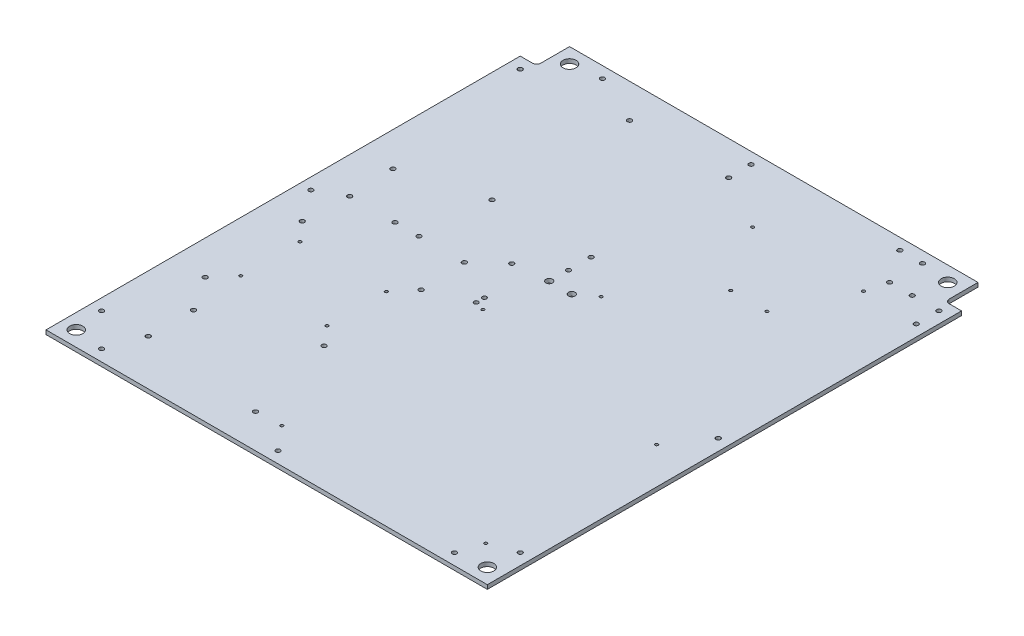
from build123d import *

# Parameters (mm, degrees)
SKETCH1_W                 = 340.868
SKETCH1_H                 = 391.668
BOSS_EXTRUDE1_DEPTH       = 3.175
CUT_EXTRUDE1_DEPTH        = 10
F_3_8_CLEARANCE_HOLE1_D   = 10.0838
F_4_40_TAPPED_HOLE2_D     = 2.2606
F_8_32_TAPPED_HOLE2_D     = 3.4544
F_4_CLEARANCE_HOLE1_D     = 3.2639
F_4_CLEARANCE_HOLE1_DEPTH = 8.01
F_4_CLEARANCE_HOLE1_TIP   = 0.980574487
F_10_CLEARANCE_HOLE1_D    = 5.1054


with BuildPart() as part:
    # Sketch1 → Boss-Extrude1 (new body)
    with BuildSketch(Plane(origin=(0, 0, 0), x_dir=(1, 0, 0), z_dir=(0, 1, 0))):
        Rectangle(SKETCH1_W, SKETCH1_H)
    extrude(amount=BOSS_EXTRUDE1_DEPTH)

    # Sketch2 → Cut-Extrude1 (cut)
    with BuildSketch(Plane(origin=(0, 3.175, 0), x_dir=(1, 0, 0), z_dir=(0, 1, 0))):
        with BuildLine():
            Line((-170.434, 195.834), (-157.734, 195.834))
            Line((-157.734, 195.834), (-157.734, 173.609))
            ThreePointArc((-157.734, 173.609), (-158.66393597, 171.36393597), (-160.909, 170.434))
            Line((-160.909, 170.434), (-170.434, 170.434))
            Line((-170.434, 170.434), (-170.434, 195.834))
        make_face()
        with BuildLine():
            Line((170.434, 195.834), (157.734, 195.834))
            Line((157.734, 195.834), (157.734, 173.609))
            ThreePointArc((157.734, 173.609), (158.66393597, 171.36393597), (160.909, 170.434))
            Line((160.909, 170.434), (170.434, 170.434))
            Line((170.434, 170.434), (170.434, 195.834))
        make_face()
    extrude(amount=-CUT_EXTRUDE1_DEPTH, mode=Mode.SUBTRACT)

    # 3/8 Clearance Hole1 (through all)
    with Locations(Plane(origin=(0, 3.175, 0), x_dir=(1, 0, 0), z_dir=(0, 1, 0))):
        with Locations((158.75, -184.15), (-158.75, -184.15), (-146.05, 184.15), (146.05, 184.15)):
            Hole(F_3_8_CLEARANCE_HOLE1_D / 2)

    # #4-40 Tapped Hole2 (through all)
    with Locations(Plane(origin=(0, 3.175, 0), x_dir=(1, 0, 0), z_dir=(0, 1, 0))):
        with Locations((119.375, 145.759), (33.725, 145.759), (21.73, 40.754), (67.7, 94.894), (95.6, 94.894), (-15.34, -13.51), (142.14, -36.73), (-15.34, -168.81), (142.14, -168.81), (-64.65313, -38.806), (-64.65313, -84.526), (-131.32813, -38.806), (-131.32813, -84.526)):
            Hole(F_4_40_TAPPED_HOLE2_D / 2)

    # #8-32 Tapped Hole2 (through all)
    with Locations(Plane(origin=(0, 3.175, 0), x_dir=(1, 0, 0), z_dir=(0, 1, 0))):
        with Locations((-161.684, -161.684), (-161.684, 0), (-161.684, 161.684), (-144.184, 45.834), (-8.584, 45.834), (-144.184, -24.166), (-52.384, -24.166), (-144.184, -99.166), (-52.384, -99.166), (-34.884, 28.334), (-34.884, -169.584), (-136.284, -187.084), (0, -187.084), (136.284, -187.084), (161.684, -161.684), (161.684, -8.75), (161.684, 144.184), (141.084, 161.684), (161.684, 161.684), (123.584, 161.684), (123.584, 187.084), (106.084, 187.084), (-123.584, 187.084), (-8.75, 187.084), (-8.584, 169.584), (-8.584, 63.334), (-142.534, 10.834), (-107.534, 10.834), (-89.034, 10.834), (-54.034, 10.834), (-85.134, 63.334), (-85.134, 169.584), (-126.684, -125.625), (-126.684, -160.625)):
            Hole(F_8_32_TAPPED_HOLE2_D / 2)

    # #4 Clearance Hole1
    with Locations(Plane(origin=(0, 3.175, 0), x_dir=(1, 0, 0), z_dir=(0, 1, 0))):
        with Locations((-22.642, -11.3606), (-22.642, -5.0106)):
            Hole(F_4_CLEARANCE_HOLE1_D / 2, depth=F_4_CLEARANCE_HOLE1_DEPTH)
            with Locations((0, 0, -(F_4_CLEARANCE_HOLE1_DEPTH + F_4_CLEARANCE_HOLE1_TIP / 2))):  # 118° drill point
                Cone(0, F_4_CLEARANCE_HOLE1_D / 2, F_4_CLEARANCE_HOLE1_TIP, mode=Mode.SUBTRACT)

    # #10 Clearance Hole1 (through all)
    with Locations(Plane(origin=(0, 0, 0), x_dir=(-1, 0, 0), z_dir=(0, -1, 0))):
        with Locations((8.7376, 31.1216), (-8.7376, 31.1216)):
            Hole(F_10_CLEARANCE_HOLE1_D / 2)


solid = part.part
